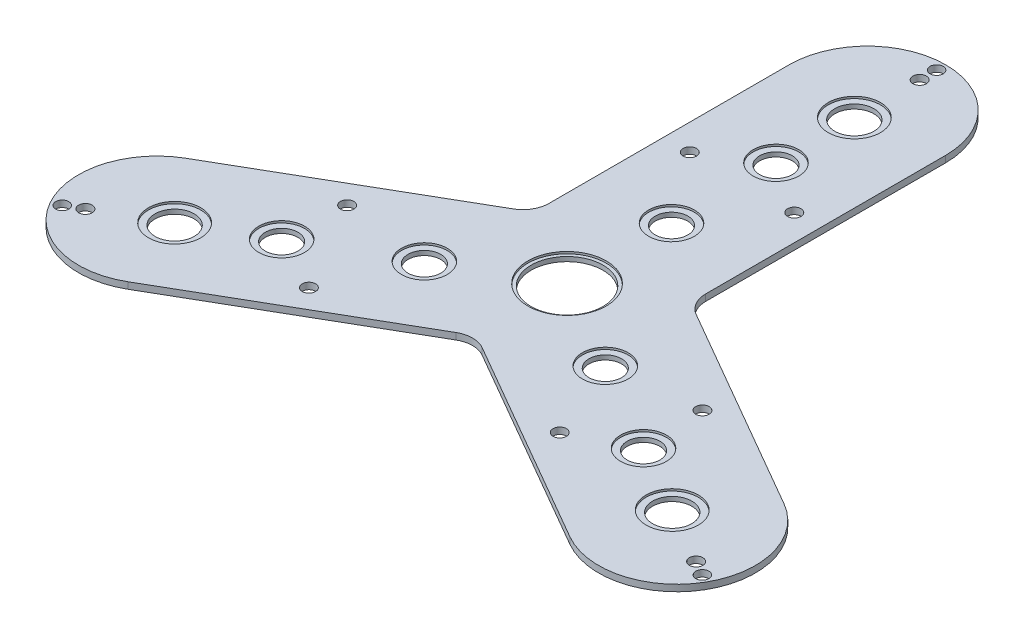
from build123d import *

# Parameters (mm, degrees)
BOSS_EXTRUDE1_DEPTH = 3.175
VARFILLET1_R        = 12.7
SKETCH2_R           = 17.4625
SKETCH2_R_2         = 7.9375
SKETCH2_R_3         = 9.525
SKETCH2_R_4         = 3.2639
SKETCH2_R_5         = 3.175
CUT_EXTRUDE1_DEPTH  = 3.175
SKETCH2_3_R         = 19.05
SKETCH2_3_R_2       = 17.4625
SKETCH2_3_R_3       = 11.1125
SKETCH2_3_R_4       = 7.9375
SKETCH2_3_R_5       = 12.7
SKETCH2_3_R_6       = 9.525
CUT_EXTRUDE2_DEPTH  = 0.9906
CIRPATTERN1_COUNT   = 3
CIRPATTERN2_COUNT   = 3


with BuildPart() as part:
    # Sketch1 → Boss-Extrude1 (new body)
    with BuildSketch(Plane(origin=(0, 0, 0), x_dir=(1, 0, 0), z_dir=(0, 1, 0))):
        with BuildLine():
            ThreePointArc((38.1, 146.05), (0, 184.15), (-38.1, 146.05))
            Line((-38.1, 146.05), (-38.1, 21.997045256))
            Line((-38.1, 21.997045256), (-145.533010223, -40.029432116))
            ThreePointArc((-145.533010223, -40.029432116), (-159.478578107, -92.075), (-107.433010223, -106.020567884))
            Line((-107.433010223, -106.020567884), (0, -43.994090512))
            Line((0, -43.994090512), (107.433010223, -106.020567884))
            ThreePointArc((107.433010223, -106.020567884), (159.478578107, -92.075), (145.533010223, -40.029432116))
            Line((145.533010223, -40.029432116), (38.1, 21.997045256))
            Line((38.1, 21.997045256), (38.1, 146.05))
        make_face()
    extrude(amount=BOSS_EXTRUDE1_DEPTH)

    # VarFillet1
    varfillet1_edges = [part.edges().sort_by_distance(p)[0] for p in [
        (0, 1.5875, 43.994090512),
        (-38.1, 1.5875, -21.997045256),
        (38.1, 1.5875, -21.997045256),
    ]]
    fillet(varfillet1_edges, radius=VARFILLET1_R)

    # Sketch2 → Cut-Extrude1 (cut)
    with BuildSketch(Plane(origin=(0, 3.175, 0), x_dir=(1, 0, 0), z_dir=(0, 1, 0))):
        Circle(SKETCH2_R)
        with Locations((0, 50.8)):
            Circle(SKETCH2_R_2)
        with Locations((0, 101.6)):
            Circle(SKETCH2_R_2)
        with Locations((0, 139.7)):
            Circle(SKETCH2_R_3)
        with Locations((-25.4, 85.09)):
            Circle(SKETCH2_R_4)
        with Locations((25.4, 85.09)):
            Circle(SKETCH2_R_4)
        with Locations((0, 171.45)):
            Circle(SKETCH2_R_4)
        with Locations((0, 179.705)):
            Circle(SKETCH2_R_5)
    cut_extrude1 = extrude(amount=-CUT_EXTRUDE1_DEPTH, mode=Mode.SUBTRACT)

    # Sketch2<3> → Cut-Extrude2 (cut)
    # profile 1 of 4: a face of its own
    with BuildSketch(Plane(origin=(0, 3.175, 0), x_dir=(1, 0, 0), z_dir=(0, 1, 0))):
        Circle(SKETCH2_3_R)
        Circle(SKETCH2_3_R_2, mode=Mode.SUBTRACT)
    # profile 2 of 4: a face of its own
    with BuildSketch(Plane(origin=(0, 3.175, 0), x_dir=(1, 0, 0), z_dir=(0, 1, 0))):
        with Locations((0, 50.8)):
            Circle(SKETCH2_3_R_3)
        with Locations((0, 50.8)):
            Circle(SKETCH2_3_R_4, mode=Mode.SUBTRACT)
    # profile 3 of 4: a face of its own
    with BuildSketch(Plane(origin=(0, 3.175, 0), x_dir=(1, 0, 0), z_dir=(0, 1, 0))):
        with Locations((0, 101.6)):
            Circle(SKETCH2_3_R_3)
        with Locations((0, 101.6)):
            Circle(SKETCH2_3_R_4, mode=Mode.SUBTRACT)
    # profile 4 of 4: a face of its own
    with BuildSketch(Plane(origin=(0, 3.175, 0), x_dir=(1, 0, 0), z_dir=(0, 1, 0))):
        with Locations((0, 139.7)):
            Circle(SKETCH2_3_R_5)
        with Locations((0, 139.7)):
            Circle(SKETCH2_3_R_6, mode=Mode.SUBTRACT)
    cut_extrude2 = extrude(amount=-CUT_EXTRUDE2_DEPTH, mode=Mode.SUBTRACT)

    # CirPattern1: Cut-Extrude1 ×3 about axis
    cirpattern1_axis = Axis((0, 3.175, 0), (0, 1, 0))
    for i in range(1, CIRPATTERN1_COUNT):
        add(cut_extrude1.rotate(cirpattern1_axis, i * 360 / CIRPATTERN1_COUNT), mode=Mode.SUBTRACT)

    # CirPattern2: Cut-Extrude2 ×3 about axis
    cirpattern2_axis = Axis((0, 2.1844, 0), (0, 1, 0))
    for i in range(1, CIRPATTERN2_COUNT):
        add(cut_extrude2.rotate(cirpattern2_axis, i * 360 / CIRPATTERN2_COUNT), mode=Mode.SUBTRACT)


solid = part.part
